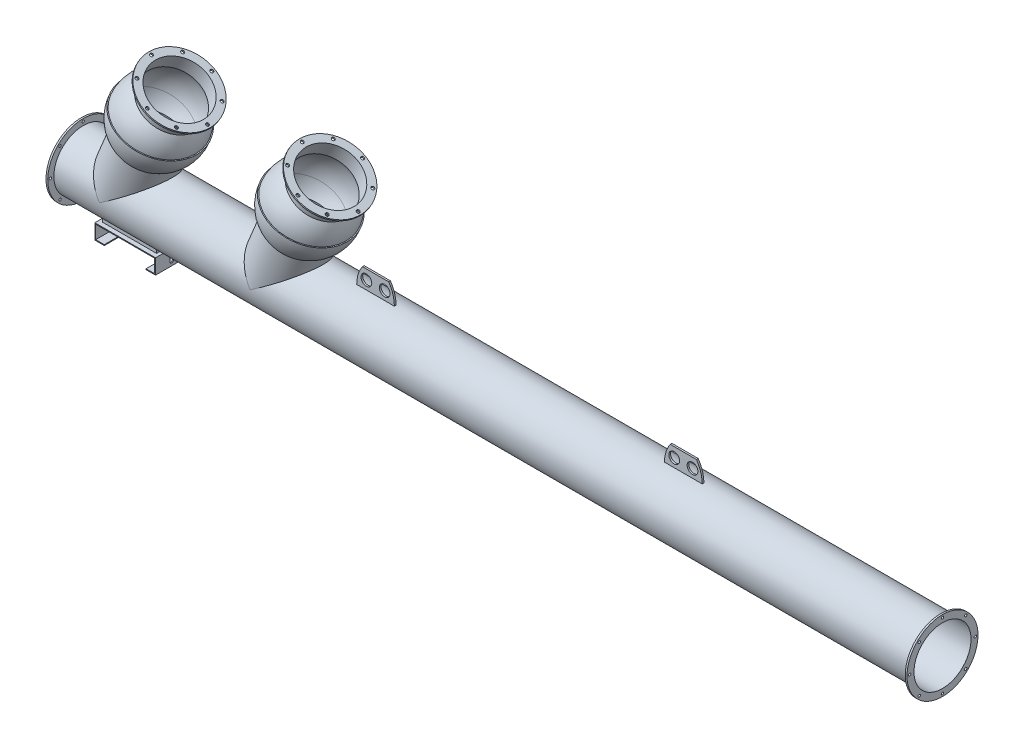
from build123d import *

# Parameters (mm, degrees)
SKIZZE1_W                                = 4000
SKIZZE1_H                                = 4
AUFSATZ_LINEAR_START                     = -8
SKIZZE2_R                                = 165
SKIZZE2_R_2                              = 136.5
AUFSATZ_LINEAR_AUSTRAGEN1_DEPTH          = 8
SKIZZE3_R                                = 165
SKIZZE3_R_2                              = 136.5
AUFSATZ_LINEAR_AUSTRAGEN2_DEPTH          = 8
DURCHGANGSLOCH_F_R_M101_D                = 11
DURCHGANGSLOCH_F_R_M101_DEPTH            = 8.001
DURCHGANGSLOCH_F_R_M102_D                = 11
KREISMUSTER1_COUNT                       = 8
SKIZZE9_R                                = 132.5
SCHNITT_LINEAR_AUSTRAGEN3_DEPTH          = 370
AUFSATZ_LINEAR_AUSTRAGEN3_REACH          = 3800.243
AUFSATZ_LINEAR_AUSTRAGEN3_END_RADIUS     = 136.5
AUFSATZ_LINEAR_START_2                   = -121
SKIZZE10_R                               = 136.5
SKIZZE10_R_2                             = 132.5
SKIZZE22_R                               = 164
SKIZZE22_R_2                             = 128.5
AUFSATZ_LINEAR_AUSTRAGEN12_DEPTH         = 7
F_14_0_START                             = 522.552561899
F_14_0_14_DURCHMESSER_BOHRUNG1_OUTLINE_R = 7
F_14_0_14_DURCHMESSER_BOHRUNG1_DEPTH     = 7
KREISMUSTER3_COUNT                       = 8
SKIZZE13_R                               = 25
AUFSATZ_LINEAR_AUSTRAGEN4_DEPTH          = 4
LINEARES_MUSTER2_COUNT                   = 2
LINEARES_MUSTER2_PITCH                   = 1430
SKIZZE14_W                               = 244
SKIZZE14_H                               = 100
SCHNITT_LINEAR_AUSTRAGEN4_DEPTH          = 4040.022055624
AUFSATZ_LINEAR_AUSTRAGEN5_DEPTH          = 75
AUFSATZ_LINEAR_AUSTRAGEN5_2_DEPTH        = 75
SKIZZE18_W                               = 252
SKIZZE18_H                               = 16
SCHNITT_LINEAR_AUSTRAGEN5_DEPTH          = 25
SKIZZE19_W                               = 252
SKIZZE19_H                               = 16
SCHNITT_LINEAR_AUSTRAGEN6_DEPTH          = 25
AUFSATZ_LINEAR_START_3                   = -3848
AUFSATZ_LINEAR_AUSTRAGEN6_DEPTH          = 4
AUFSATZ_LINEAR_START_4                   = -3600
AUFSATZ_LINEAR_AUSTRAGEN6_2_DEPTH        = 4
AUFSATZ_LINEAR_AUSTRAGEN10_DEPTH         = 5
SKIZZE21_W                               = 20
SKIZZE21_H                               = 4
AUFSATZ_LINEAR_AUSTRAGEN11_DEPTH         = 244
SCHNITT_LINEAR_AUSTRAGEN7_REACH          = 3626.536
K_RPER_VERSCHIEBEN_KOPIEREN2_ANGLE       = 30
LINEARES_MUSTER4_COUNT                   = 2
LINEARES_MUSTER4_PITCH                   = 700


# Read off the part's stored shape, not the designer's step: Ø14.0 (14) Durchmesser Bohrung1, Aufsatz-Linear austragen6
with BuildPart() as part:
    # Skizze1 → Rotation1 (revolve)
    with BuildSketch(Plane.XY):
        with Locations((-2000, 134.5)):
            Rectangle(SKIZZE1_W, SKIZZE1_H)
    revolve(axis=Axis((10, 0, 0), (-1, 0, 0)))

    # Skizze2 → Aufsatz-Linear austragen1 (add)
    with BuildSketch(Plane(origin=(0, 0, 0), x_dir=(0, 0, -1), z_dir=(1, 0, 0)).offset(AUFSATZ_LINEAR_START)):
        with Locations(Location((0, 0, 0), (0, 0, 90))):
            Circle(SKIZZE2_R)
        with Locations(Location((0, 0, 0), (0, 0, 90))):
            Circle(SKIZZE2_R_2, mode=Mode.SUBTRACT)
    extrude(amount=AUFSATZ_LINEAR_AUSTRAGEN1_DEPTH)

    # Skizze3 → Aufsatz-Linear austragen2 (add)
    with BuildSketch(Plane.ZY.offset(4000)):
        with Locations(Location((0, 0, 0), (0, 0, 90))):
            Circle(SKIZZE3_R)
        with Locations(Location((0, 0, 0), (0, 0, 90))):
            Circle(SKIZZE3_R_2, mode=Mode.SUBTRACT)
    extrude(amount=-AUFSATZ_LINEAR_AUSTRAGEN2_DEPTH)

    # Durchgangsloch für M101
    with Locations(Plane(origin=(0, 0, 0), x_dir=(0, 0, -1), z_dir=(1, 0, 0))):
        with Locations((0, 152.5)):
            durchgangsloch_f_r_m101 = Hole(DURCHGANGSLOCH_F_R_M101_D / 2, depth=DURCHGANGSLOCH_F_R_M101_DEPTH)

    # Durchgangsloch für M102 (through all)
    with Locations(Plane.ZY.offset(4000)):
        with Locations((0, 152.5)):
            durchgangsloch_f_r_m102 = Hole(DURCHGANGSLOCH_F_R_M102_D / 2)

    # Kreismuster1: Durchgangsloch für M101, Durchgangsloch für M102 ×8 about axis
    kreismuster1_axis = Axis((0, 0, 0), (1, 0, 0))
    add([durchgangsloch_f_r_m101.rotate(kreismuster1_axis, i * 360 / KREISMUSTER1_COUNT) for i in range(1, KREISMUSTER1_COUNT)], mode=Mode.SUBTRACT)
    add([durchgangsloch_f_r_m102.rotate(kreismuster1_axis, i * 360 / KREISMUSTER1_COUNT) for i in range(1, KREISMUSTER1_COUNT)], mode=Mode.SUBTRACT)

    # Skizze9 → Schnitt-Linear austragen3 (cut)
    with BuildSketch(Plane(origin=(-3638.407130025, 341.835427029, 0), x_dir=(-0.9238795325112852, 0.38268343236509356, 0), z_dir=(0.38268343236509356, 0.9238795325112852, 0))):
        Circle(SKIZZE9_R)
    schnitt_linear_austragen3 = extrude(amount=-SCHNITT_LINEAR_AUSTRAGEN3_DEPTH, mode=Mode.SUBTRACT)

    # Aufsatz-Linear austragen3: up to this cylinder (the profile starts outside it)
    aufsatz_linear_austragen3_end = Plane(origin=(-3562.169186, 0, 0), z_dir=(1, 0, 0)) * Cylinder(AUFSATZ_LINEAR_AUSTRAGEN3_END_RADIUS, 7874.486, mode=Mode.PRIVATE)
    # Skizze10 → Aufsatz-Linear austragen3 (add, up to the surface)
    with BuildSketch(Plane(origin=(-3638.407130025, 341.835427029, 0), x_dir=(-0.9238795325112852, 0.38268343236509356, 0), z_dir=(0.38268343236509356, 0.9238795325112852, 0)).offset(AUFSATZ_LINEAR_START_2), mode=Mode.PRIVATE) as aufsatz_linear_austragen3_sk1:
        Circle(SKIZZE10_R)
        Circle(SKIZZE10_R_2, mode=Mode.SUBTRACT)
    aufsatz_linear_austragen3_tool1 = extrude(aufsatz_linear_austragen3_sk1.sketch, amount=-AUFSATZ_LINEAR_AUSTRAGEN3_REACH, mode=Mode.PRIVATE) - aufsatz_linear_austragen3_end
    aufsatz_linear_austragen3 = aufsatz_linear_austragen3_tool1.solids().sort_by_distance((-3562.169186, 179.28718, 0))[0]
    add(aufsatz_linear_austragen3)

    # Skizze11 → Rotation4 (revolve)
    with BuildSketch(Plane.XY):
        with BuildLine():
            Line((-3564.835483312, 180.391596919), (-3558.602269153, 177.809715077))
            ThreePointArc((-3558.602269153, 177.809715077), (-3502.226587043, 220.47600336), (-3466.309264283, 281.374078986))
            Line((-3466.309264283, 281.374078986), (-3470.928661946, 283.287496148))
            ThreePointArc((-3470.928661946, 283.287496148), (-3507.360645983, 222.237281137), (-3564.835483312, 180.391596919))
        make_face()
    rotation4 = revolve(axis=Axis((-3505.509743492, 662.678100001, 0), (-0.38268343236509267, -0.9238795325112856, 0)))

    # Skizze14 → Schnitt-Linear austragen4 (cut, through all)
    with BuildSketch(Plane(origin=(0, 0, 0), x_dir=(1, 0, 0), z_dir=(0, 1, 0))):
        with Locations((-3722, 0)):
            Rectangle(SKIZZE14_W, SKIZZE14_H)
    extrude(amount=-SCHNITT_LINEAR_AUSTRAGEN4_DEPTH, mode=Mode.SUBTRACT)



with BuildPart() as body_2:
    # Skizze12 → Rotation3 (revolve)
    with BuildSketch(Plane.XY, mode=Mode.PRIVATE) as rotation3_sk:
        with BuildLine():
            Line((-3505.907130025, 461.134482774), (-3505.907130025, 529.552561899))
            Line((-3505.907130025, 529.552561899), (-3509.907130025, 529.552561899))
            Line((-3509.907130025, 529.552561899), (-3509.907130025, 459.154436572))
            ThreePointArc((-3509.907130025, 459.154436572), (-3467.023155212, 371.894255637), (-3477.652091368, 275.248509798))
            Line((-3477.652091368, 275.248509798), (-3473.720604791, 273.620034737))
            ThreePointArc((-3473.720604791, 273.620034737), (-3462.658961481, 372.038350602), (-3505.907130025, 461.134482774))
        make_face()
    revolve(rotation3_sk.sketch.rotate(Axis((-3638.407130025, 341.835427029, 0), (0, 1, 0)), 90), axis=Axis((-3638.407130025, 341.835427029, 0), (0, 1, 0)))

    # Skizze22 → Aufsatz-Linear austragen12 (add)
    with BuildSketch(Plane(origin=(0, 529.552561899, 0), x_dir=(1, 0, 0), z_dir=(0, 1, 0))):
        with Locations(Location((-3638.407130025, 0, 0), (0, 0, 270))):
            Circle(SKIZZE22_R)
        with Locations(Location((-3638.407130025, 0, 0), (0, 0, 90))):
            Circle(SKIZZE22_R_2, mode=Mode.SUBTRACT)
    extrude(amount=-AUFSATZ_LINEAR_AUSTRAGEN12_DEPTH)

    # Ø14.0 (14) Durchmesser Bohrung1 outline → Ø14.0 (14) Durchmesser Bohrung1 (cut)
    with BuildSketch(Plane(origin=(0, 0, 0), x_dir=(1, 0, 0), z_dir=(0, 1, 0)).offset(F_14_0_START)):
        with Locations((-3788.407130025, 0)):
            Circle(F_14_0_14_DURCHMESSER_BOHRUNG1_OUTLINE_R)
    f_14_0_14_durchmesser_bohrung1 = extrude(amount=F_14_0_14_DURCHMESSER_BOHRUNG1_DEPTH, mode=Mode.SUBTRACT)

    # Kreismuster3: Ø14.0 (14) Durchmesser Bohrung1 ×8 about axis
    kreismuster3_axis = Axis((-3638.407130025, 0, 0), (0, 1, 0))
    for i in range(1, KREISMUSTER3_COUNT):
        add(f_14_0_14_durchmesser_bohrung1.rotate(kreismuster3_axis, i * 360 / KREISMUSTER3_COUNT), mode=Mode.SUBTRACT)


with BuildPart() as body_3:
    # Skizze13 → Aufsatz-Linear austragen4 (new, symmetric)
    with BuildSketch(Plane.XY):
        with BuildLine():
            Line((-1287.5, 136.5), (-1112.5, 136.5))
            ThreePointArc((-1112.5, 136.5), (-1119.254039077, 181.003872632), (-1138.907929057, 221.5))
            Line((-1138.907929057, 221.5), (-1261.092070943, 221.5))
            ThreePointArc((-1261.092070943, 221.5), (-1280.745960923, 181.003872632), (-1287.5, 136.5))
        make_face()
        with Locations((-1242.5, 176.5)):
            Circle(SKIZZE13_R, mode=Mode.SUBTRACT)
        with Locations(Location((-1157.5, 176.5, 0), (0, 0, 180))):
            Circle(SKIZZE13_R, mode=Mode.SUBTRACT)
    extrude(amount=AUFSATZ_LINEAR_AUSTRAGEN4_DEPTH, both=True)


with BuildPart() as lineares_muster2_1:
    # Lineares Muster2: pattern copy
    add(body_3.part.moved(Location(Vector(-1, 0, 0) * (1 * LINEARES_MUSTER2_PITCH))))


with BuildPart() as body_5:
    # Skizze15 → Aufsatz-Linear austragen5 (new, symmetric)
    with BuildSketch(Plane.XY):
        Polygon((-3844, -136.5), (-3844, -156.5), (-3859, -156.5), (-3859, -218.5), (-3819, -218.5), (-3819, -222.5), (-3863, -222.5), (-3863, -152.5), (-3848, -152.5), (-3848, -136.5), align=None)
    extrude(amount=AUFSATZ_LINEAR_AUSTRAGEN5_DEPTH, both=True)


with BuildPart() as body_6:
    # Skizze15 → Aufsatz-Linear austragen5 2 (new, symmetric)
    with BuildSketch(Plane.XY):
        Polygon((-3596, -136.5), (-3600, -136.5), (-3600, -156.5), (-3585, -156.5), (-3585, -218.5), (-3625, -218.5), (-3625, -222.5), (-3581, -222.5), (-3581, -152.5), (-3596, -152.5), align=None)
    extrude(amount=AUFSATZ_LINEAR_AUSTRAGEN5_2_DEPTH, both=True)


with BuildPart() as schnitt_linear_austragen5_tool:
    # Skizze18 → Schnitt-Linear austragen5 (new body)
    with BuildSketch(Plane.XY.offset(75)):
        with Locations((-3722, -144.5)):
            Rectangle(SKIZZE18_W, SKIZZE18_H)
    extrude(amount=-SCHNITT_LINEAR_AUSTRAGEN5_DEPTH)


with BuildPart() as body_5_1:
    add(body_5.part)

    # Schnitt-Linear austragen5: cut by schnitt_linear_austragen5_tool
    add(schnitt_linear_austragen5_tool.part, mode=Mode.SUBTRACT)


with BuildPart() as body_6_1:
    add(body_6.part)

    # Schnitt-Linear austragen5: cut by schnitt_linear_austragen5_tool
    add(schnitt_linear_austragen5_tool.part, mode=Mode.SUBTRACT)


with BuildPart() as schnitt_linear_austragen6_tool:
    # Skizze19 → Schnitt-Linear austragen6 (new body)
    with BuildSketch(Plane(origin=(0, 0, -75), x_dir=(-1, 0, 0), z_dir=(0, 0, -1))):
        with Locations((3722, -144.5)):
            Rectangle(SKIZZE19_W, SKIZZE19_H)
    extrude(amount=-SCHNITT_LINEAR_AUSTRAGEN6_DEPTH)


with BuildPart() as body_5_2:
    add(body_5_1.part)

    # Schnitt-Linear austragen6: cut by schnitt_linear_austragen6_tool
    add(schnitt_linear_austragen6_tool.part, mode=Mode.SUBTRACT)


with BuildPart() as body_6_2:
    add(body_6_1.part)

    # Schnitt-Linear austragen6: cut by schnitt_linear_austragen6_tool
    add(schnitt_linear_austragen6_tool.part, mode=Mode.SUBTRACT)


with BuildPart() as part_1:
    add(part.part)

    add(body_5_2.part)  # Aufsatz-Linear austragen6 merges body 5

    add(body_6_2.part)  # Aufsatz-Linear austragen6 merges body 6
    # Aufsatz-Linear austragen6 outline → Aufsatz-Linear austragen6 (add)
    with BuildSketch(Plane.YZ.offset(AUFSATZ_LINEAR_START_3)):
        with BuildLine():
            Line((-127.012794631, 50), (-136.5, 50))
            Line((-136.5, 50), (-136.5, -1.4e-08))
            ThreePointArc((-136.5, -1.4e-08), (-134.107226628, 25.446056003), (-127.012794631, 50))
        make_face()
        with BuildLine():
            ThreePointArc((-127.012794631, -50), (-134.107226626, -25.446056016), (-136.5, -1.4e-08))
            Line((-136.5, -1.4e-08), (-136.5, -50))
            Line((-136.5, -50), (-127.012794631, -50))
        make_face()
    extrude(amount=AUFSATZ_LINEAR_AUSTRAGEN6_DEPTH)

    # Aufsatz-Linear austragen6 2 outline → Aufsatz-Linear austragen6 2 (add)
    with BuildSketch(Plane.YZ.offset(AUFSATZ_LINEAR_START_4)):
        with BuildLine():
            Line((-127.012794631, 50), (-136.5, 50))
            Line((-136.5, 50), (-136.5, -1.4e-08))
            ThreePointArc((-136.5, -1.4e-08), (-134.107226628, 25.446056003), (-127.012794631, 50))
        make_face()
        with BuildLine():
            ThreePointArc((-127.012794631, -50), (-134.107226626, -25.446056016), (-136.5, -1.4e-08))
            Line((-136.5, -1.4e-08), (-136.5, -50))
            Line((-136.5, -50), (-127.012794631, -50))
        make_face()
    extrude(amount=AUFSATZ_LINEAR_AUSTRAGEN6_2_DEPTH)

    # Skizze17 → Aufsatz-Linear austragen10 (add)
    with BuildSketch(Plane.XY.offset(50)):
        Polygon((-3848, -152.5), (-3844, -152.5), (-3844, -156.5), (-3600, -156.5), (-3600, -152.5), (-3596, -152.5), (-3596, -126.5), (-3848, -126.5), align=None)
    aufsatz_linear_austragen10 = extrude(amount=AUFSATZ_LINEAR_AUSTRAGEN10_DEPTH)

    # Spiegeln1: Aufsatz-Linear austragen10 across plane
    add(aufsatz_linear_austragen10.mirror(Plane.XY))

    # Skizze21 → Aufsatz-Linear austragen11 (add)
    with BuildSketch(Plane(origin=(-3844, 0, 0), x_dir=(0, 0, -1), z_dir=(1, 0, 0))):
        with Locations((-65, -154.5)):
            Rectangle(SKIZZE21_W, SKIZZE21_H)
        with Locations((65, -154.5)):
            Rectangle(SKIZZE21_W, SKIZZE21_H)
    extrude(amount=AUFSATZ_LINEAR_AUSTRAGEN11_DEPTH)

    # Schnitt-Linear austragen7: up to this face of the body (flat: up to its plane)
    schnitt_linear_austragen7_end = Plane(part_1.part.faces().sort_by_distance((-3863, -187.5, 0))[0])
    # Skizze20 → Schnitt-Linear austragen7 (cut, up to the picked face)
    with BuildSketch(Plane(origin=(-3581, 0, 0), x_dir=(0, 0, -1), z_dir=(1, 0, 0)), mode=Mode.PRIVATE) as schnitt_linear_austragen7_sk1:
        with BuildLine():
            Line((8, -172.5), (8, -202.5))
            ThreePointArc((8, -202.5), (0, -210.5), (-8, -202.5))
            Line((-8, -202.5), (-8, -172.5))
            ThreePointArc((-8, -172.5), (0, -164.5), (8, -172.5))
        make_face()
    schnitt_linear_austragen7_tool1 = split(extrude(schnitt_linear_austragen7_sk1.sketch, amount=-SCHNITT_LINEAR_AUSTRAGEN7_REACH, mode=Mode.PRIVATE), bisect_by=schnitt_linear_austragen7_end, keep=Keep.BOTH, mode=Mode.PRIVATE)
    add(schnitt_linear_austragen7_tool1.solids().sort_by(Axis((-3581, -187.5, 0), (-1, 0, 0)))[0], mode=Mode.SUBTRACT)

    # Lineares Muster4: Schnitt-Linear austragen3, Aufsatz-Linear austragen3, Rotation4 ×2
    with Locations(*[(i * LINEARES_MUSTER4_PITCH, 0, 0) for i in range(1, LINEARES_MUSTER4_COUNT)]):
        add(schnitt_linear_austragen3, mode=Mode.SUBTRACT)
        add(aufsatz_linear_austragen3)
        add(rotation4)


with BuildPart() as body_2_1:
    # Körper-Verschieben/Kopieren2: moved
    add(body_2.part.rotate(Axis((-3638.407130025, 341.835427029, 0), (0, 0, -1)), K_RPER_VERSCHIEBEN_KOPIEREN2_ANGLE))


with BuildPart() as body_5_2_1:
    # Körper-Verschieben/Kopieren3: copy of body 2
    add(body_2_1.part.moved(Location((700, 0, 0))))


solid = Compound([body_3.part, lineares_muster2_1.part, part_1.part, body_2_1.part, body_5_2_1.part])
